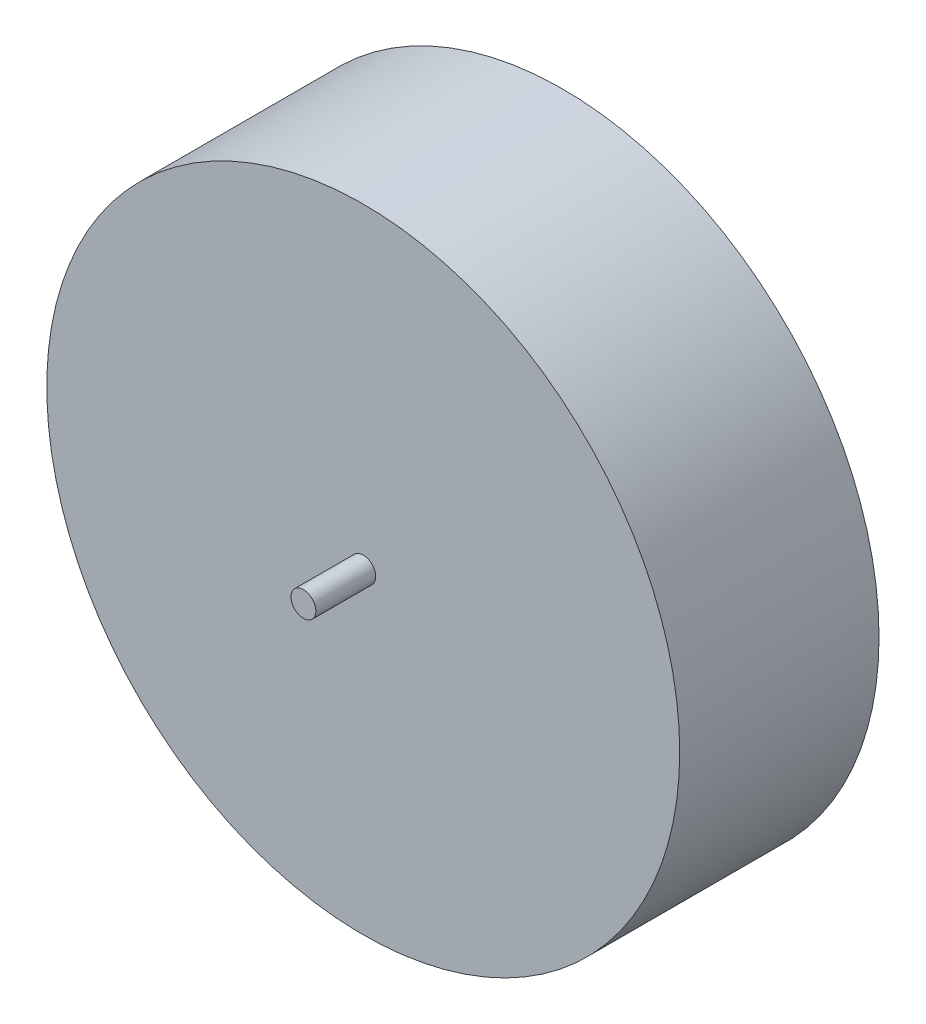
from build123d import *

# Parameters (mm, degrees)
SKETCH1_R           = 190.5
BOSS_EXTRUDE1_DEPTH = 60
SKETCH2_R           = 7.5
BOSS_EXTRUDE2_DEPTH = 96


with BuildPart() as part:
    # Sketch1 → Boss-Extrude1 (new, symmetric)
    with BuildSketch(Plane.XY):
        Circle(SKETCH1_R)
    extrude(amount=BOSS_EXTRUDE1_DEPTH, both=True)

    # Sketch2 → Boss-Extrude2 (add, symmetric)
    with BuildSketch(Plane.XY):
        Circle(SKETCH2_R)
    extrude(amount=BOSS_EXTRUDE2_DEPTH, both=True)


solid = part.part
